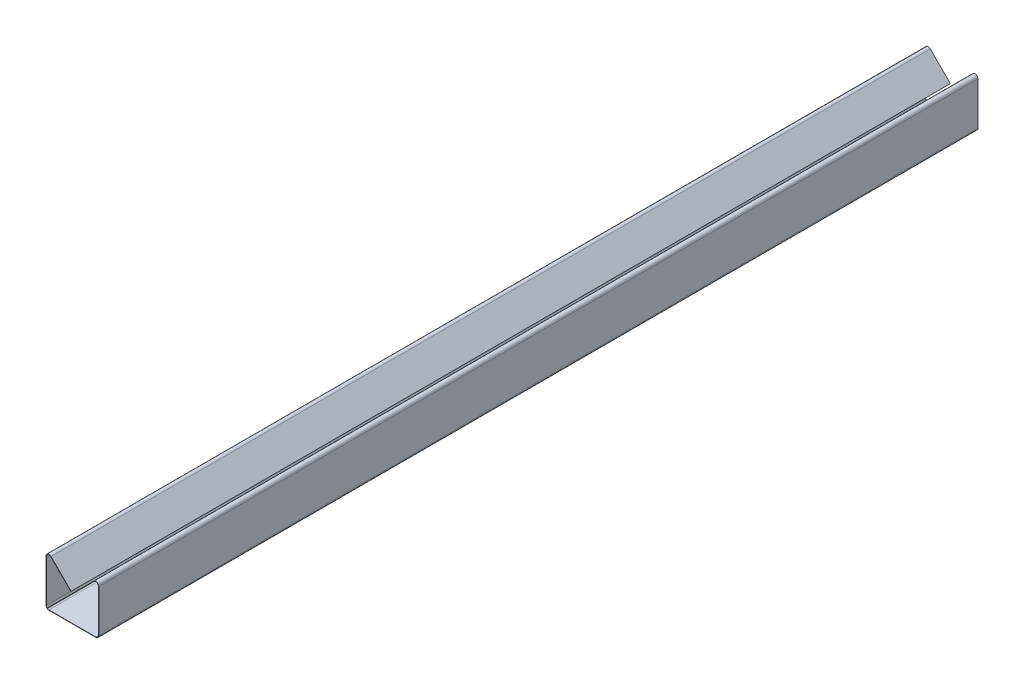
from build123d import *

# Parameters (mm, degrees)
Z_KLADN_PLECH1_DEPTH = 250


# Sheet-metal steps are written as plain solids
with BuildPart() as part:
    # Skica1 → Základní plech1 (new body)
    with BuildSketch(Plane.XY):
        with BuildLine():
            Line((-0.353553391, 0.353553391), (-6.071834467, 6.071834467))
            ThreePointArc((-6.071834467, 6.071834467), (-6.98355296, 6.253186551), (-7.5, 5.480268934))
            Line((-7.5, 5.480268934), (-7.5, -6.6634))
            ThreePointArc((-7.5, -6.6634), (-7.254965533, -7.254965533), (-6.6634, -7.5))
            Line((-6.6634, -7.5), (6.6634, -7.5))
            ThreePointArc((6.6634, -7.5), (7.254965533, -7.254965533), (7.5, -6.6634))
            Line((7.5, -6.6634), (7.5, 5.480268934))
            ThreePointArc((7.5, 5.480268934), (6.98355296, 6.253186551), (6.071834467, 6.071834467))
            Line((6.071834467, 6.071834467), (-7.146446609, -7.146446609))
            Line((-7.146446609, -7.146446609), (-7.075735931, -7.217157288))
            Line((-7.075735931, -7.217157288), (6.142545145, 6.001123789))
            ThreePointArc((6.142545145, 6.001123789), (6.945284616, 6.160798597), (7.4, 5.480268934))
            Line((7.4, 5.480268934), (7.4, -6.6634))
            ThreePointArc((7.4, -6.6634), (7.184254855, -7.184254855), (6.6634, -7.4))
            Line((6.6634, -7.4), (-6.6634, -7.4))
            ThreePointArc((-6.6634, -7.4), (-7.184254855, -7.184254855), (-7.4, -6.6634))
            Line((-7.4, -6.6634), (-7.4, 5.480268934))
            ThreePointArc((-7.4, 5.480268934), (-6.945284616, 6.160798597), (-6.142545145, 6.001123789))
            Line((-6.142545145, 6.001123789), (-0.424264069, 0.282842712))
            Line((-0.424264069, 0.282842712), (-0.353553391, 0.353553391))
        make_face()
    extrude(amount=Z_KLADN_PLECH1_DEPTH)


solid = part.part
